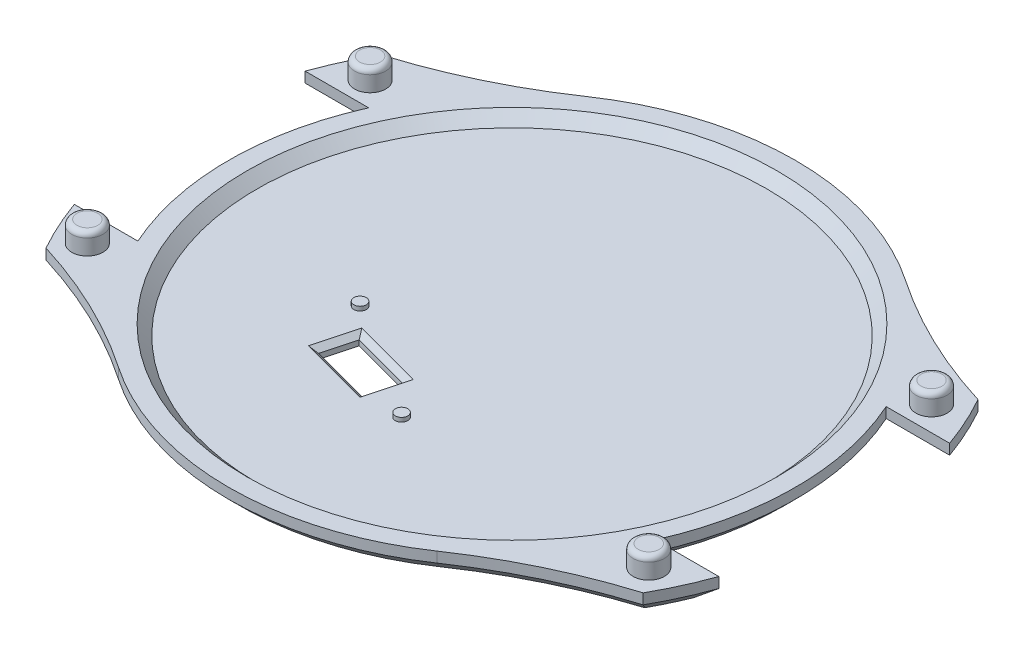
from build123d import *

# Parameters (mm, degrees)
SKETCH1_R           = 1.2
SKETCH1_R_2         = 27.25
SKETCH1_R_3         = 25.5
BOSS_EXTRUDE1_DEPTH = 2
SKETCH2_R           = 25.5
BOSS_EXTRUDE3_DEPTH = 1
SKETCH3_R           = 1.5
BOSS_EXTRUDE4_DEPTH = 4
CHAMFER1_SIZE       = 1
CHAMFER2_SIZE       = 1
CUT_EXTRUDE1_DEPTH  = 2
SKETCH5_R           = 0.6
BOSS_EXTRUDE5_DEPTH = 0.4
CHAMFER3_SIZE       = 0.5
FILLET1_R           = 0.5


with BuildPart() as part:
    # Sketch1 → Boss-Extrude1 (new body)
    # profile 1 of 5: a face of its own
    with BuildSketch(Plane(origin=(0, 0, 0), x_dir=(1, 0, 0), z_dir=(0, 1, 0))):
        with BuildLine():
            ThreePointArc((-28.722813233, 16.1), (-29.965874009, 13.647578353), (-31, 11.1))
            Line((-31, 11.1), (-24.886793687, 11.1))
            ThreePointArc((-24.886793687, 11.1), (-20.899896158, 17.485904054), (-15.317841085, 22.537219094))
            ThreePointArc((-15.317841085, 22.537219094), (-21.77967806, 18.817477861), (-28.722813233, 16.1))
        make_face()
        with Locations(Location((-27.128197522, 13.481505135, 0), (0, 0, 270))):
            Circle(SKETCH1_R, mode=Mode.SUBTRACT)
    # profile 2 of 5: a face of its own
    with BuildSketch(Plane(origin=(0, 0, 0), x_dir=(1, 0, 0), z_dir=(0, 1, 0))):
        with BuildLine():
            ThreePointArc((-15.317841085, -22.537219094), (-20.899896158, -17.485904054), (-24.886793687, -11.1))
            Line((-24.886793687, -11.1), (-31, -11.1))
            ThreePointArc((-31, -11.1), (-29.965874009, -13.647578353), (-28.722813233, -16.1))
            ThreePointArc((-28.722813233, -16.1), (-21.77967806, -18.817477861), (-15.317841085, -22.537219094))
        make_face()
        with Locations(Location((-27.128197522, -13.718494865, 0), (0, 0, 270))):
            Circle(SKETCH1_R, mode=Mode.SUBTRACT)
    # profile 3 of 5: a face of its own
    with BuildSketch(Plane(origin=(0, 0, 0), x_dir=(1, 0, 0), z_dir=(0, 1, 0))):
        Circle(SKETCH1_R_2)
        with Locations(Location((0, 0, 0), (0, 0, 270))):
            Circle(SKETCH1_R_3, mode=Mode.SUBTRACT)
    # profile 4 of 5: a face of its own
    with BuildSketch(Plane(origin=(0, 0, 0), x_dir=(1, 0, 0), z_dir=(0, 1, 0))):
        with BuildLine():
            ThreePointArc((24.886793687, -11.1), (20.899896158, -17.485904054), (15.317841085, -22.537219094))
            ThreePointArc((15.317841085, -22.537219094), (21.77967806, -18.817477861), (28.722813233, -16.1))
            ThreePointArc((28.722813233, -16.1), (29.965874009, -13.647578353), (31, -11.1))
            Line((31, -11.1), (24.886793687, -11.1))
        make_face()
        with Locations(Location((26.871802478, -13.718494865, 0), (0, 0, 270))):
            Circle(SKETCH1_R, mode=Mode.SUBTRACT)
    # profile 5 of 5: a face of its own
    with BuildSketch(Plane(origin=(0, 0, 0), x_dir=(1, 0, 0), z_dir=(0, 1, 0))):
        with BuildLine():
            ThreePointArc((28.722813233, 16.1), (21.77967806, 18.817477861), (15.317841085, 22.537219094))
            ThreePointArc((15.317841085, 22.537219094), (20.899896158, 17.485904054), (24.886793687, 11.1))
            Line((24.886793687, 11.1), (31, 11.1))
            ThreePointArc((31, 11.1), (29.965874009, 13.647578353), (28.722813233, 16.1))
        make_face()
        with Locations(Location((26.871802478, 13.481505135, 0), (0, 0, 270))):
            Circle(SKETCH1_R, mode=Mode.SUBTRACT)
    extrude(amount=BOSS_EXTRUDE1_DEPTH)

    # Sketch2 → Boss-Extrude3 (add)
    with BuildSketch(Plane.XZ):
        with Locations(Location((0, 0, 0), (0, 0, 270))):
            Circle(SKETCH2_R)
    extrude(amount=-BOSS_EXTRUDE3_DEPTH)

    # Sketch3 → Boss-Extrude4 (add)
    with BuildSketch(Plane.XZ):
        with Locations(Location((-27.128197522, 13.718494865, 0), (0, 0, 270))):
            Circle(SKETCH3_R)
        with Locations(Location((26.871802478, 13.718494865, 0), (0, 0, 270))):
            Circle(SKETCH3_R)
        with Locations(Location((26.871802478, -13.481505135, 0), (0, 0, 270))):
            Circle(SKETCH3_R)
        with Locations(Location((-27.128197522, -13.481505135, 0), (0, 0, 270))):
            Circle(SKETCH3_R)
    extrude(amount=-BOSS_EXTRUDE4_DEPTH)

    # Chamfer1
    chamfer1_edges = [part.edges().sort_by_distance(p)[0] for p in [
        (0, 0, -27.25),
        (21.77967806, 0, -18.817477861),
        (29.965874009, 0, -13.647578353),
        (27.943396843, 0, -11.1),
        (27.25, 0, 0),
        (27.943396843, 0, 11.1),
        (29.965874009, 0, 13.647578353),
        (21.77967806, 0, 18.817477861),
        (0, 0, 27.25),
        (-21.77967806, 0, 18.817477861),
        (-29.965874009, 0, 13.647578353),
        (-27.943396843, 0, 11.1),
        (-27.25, 0, 0),
        (-27.943396843, 0, -11.1),
        (-29.965874009, 0, -13.647578353),
        (-21.77967806, 0, -18.817477861),
    ]]
    chamfer(chamfer1_edges, length=CHAMFER1_SIZE)

    # Chamfer2
    chamfer2_edges = [part.edges().sort_by_distance(p)[0] for p in [
        (0, 1, -25.5),
    ]]
    chamfer(chamfer2_edges, length=CHAMFER2_SIZE - 0.0001)  # a hair under: the kernel refuses the full size

    # Sketch4 → Cut-Extrude1 (cut)
    with BuildSketch(Plane(origin=(0, 1, 0), x_dir=(1, 0, 0), z_dir=(0, 1, 0))):
        Polygon((-7.518498865, -7.181133816), (-1.722943541, -8.734046717), (-2.551163755, -11.825009557), (-8.346719079, -10.272096656), align=None)
    extrude(amount=-CUT_EXTRUDE1_DEPTH, mode=Mode.SUBTRACT)

    # Sketch5 → Boss-Extrude5 (add)
    with BuildSketch(Plane(origin=(0, 1, 0), x_dir=(1, 0, 0), z_dir=(0, 1, 0))):
        with Locations(Location((1.460899698, -12.082012325, 0), (0, 0, 90))):
            Circle(SKETCH5_R)
        with Locations(Location((-9.793498218, -4.821776272, 0), (0, 0, 90))):
            Circle(SKETCH5_R)
    extrude(amount=BOSS_EXTRUDE5_DEPTH)

    # Chamfer3
    chamfer3_edges = [part.edges().sort_by_distance(p)[0] for p in [
        (-7.932608972, 1, 8.726615236),
        (-5.448941417, 1, 11.048553106),
        (-2.137053648, 1, 10.279528137),
        (-4.620721203, 1, 7.957590266),
    ]]
    chamfer(chamfer3_edges, length=CHAMFER3_SIZE)

    # Fillet1
    fillet1_edges = [part.edges().sort_by_distance(p)[0] for p in [
        (-27.128197522, 4, 15.218494865),
        (26.871802478, 4, 15.218494865),
        (26.871802478, 4, -11.981505135),
        (-27.128197522, 4, -11.981505135),
    ]]
    fillet(fillet1_edges, radius=FILLET1_R)


solid = part.part
